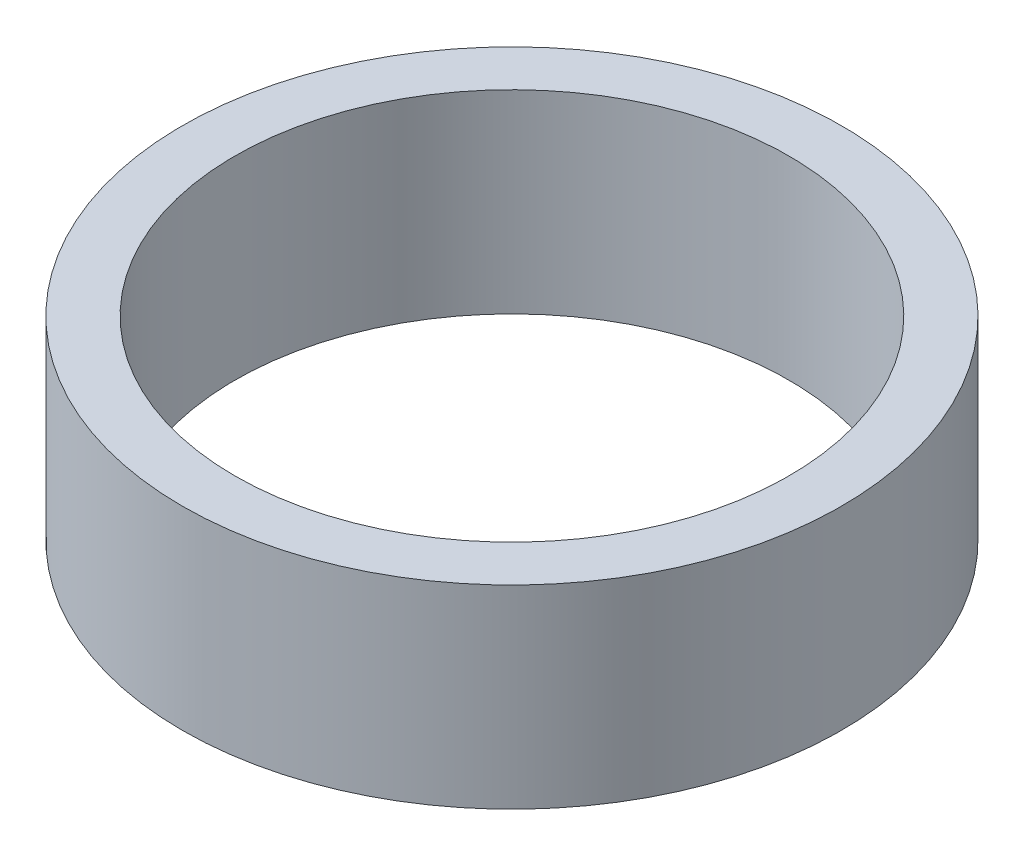
from build123d import *

# Parameters (mm, degrees)
SKETCH1_R           = 62.8
SKETCH1_R_2         = 52.8
BOSS_EXTRUDE1_DEPTH = 18.5


with BuildPart() as part:
    # Sketch1 → Boss-Extrude1 (new, symmetric)
    with BuildSketch(Plane(origin=(0, 0, 0), x_dir=(1, 0, 0), z_dir=(0, 1, 0))):
        Circle(SKETCH1_R)
        Circle(SKETCH1_R_2, mode=Mode.SUBTRACT)
    extrude(amount=BOSS_EXTRUDE1_DEPTH, both=True)


solid = part.part
